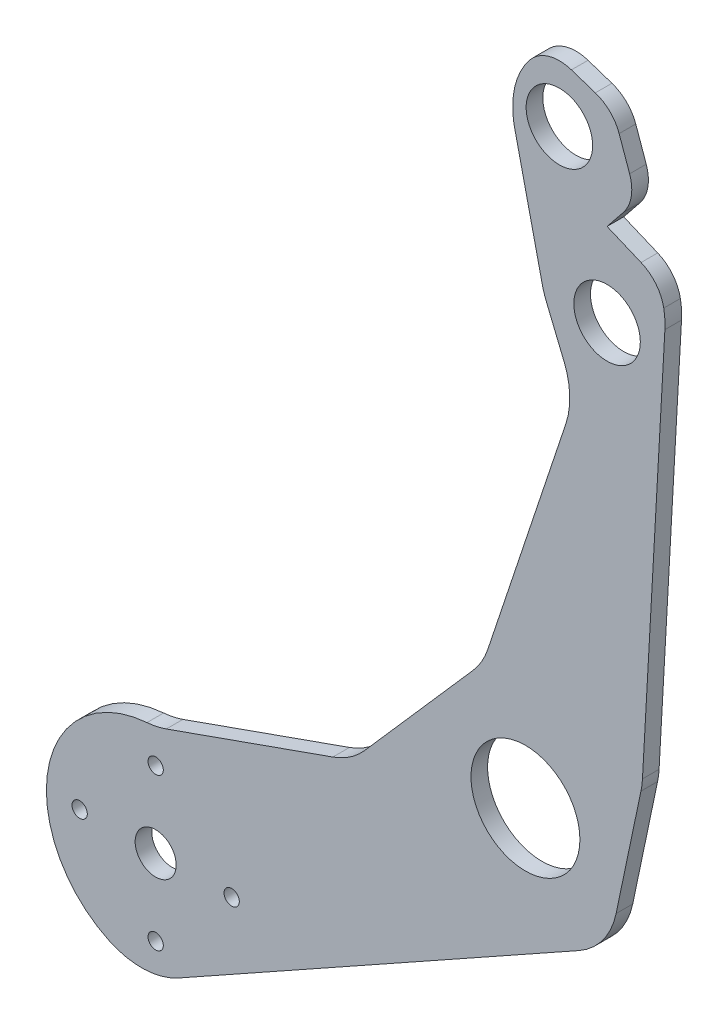
from build123d import *

# Parameters (mm, degrees)
SKETCH1_R           = 6.861165386
SKETCH1_R_2         = 18.200911839
SKETCH1_R_3         = 11.1125
SKETCH1_R_4         = 2.5527
BOSS_EXTRUDE1_DEPTH = 5.55625
FILLET1_R           = 25.4
FILLET3_R           = 12.7
FILLET4_R           = 12.7


with BuildPart() as part:
    # Sketch1 → Boss-Extrude1 (new body)
    with BuildSketch(Plane.XY):
        with BuildLine():
            Line((198.861588808, 69.615973931), (188.964925061, 57.285610842))
            Line((188.964925061, 57.285610842), (205.711419625, 50.270822653))
            Line((205.711419625, 50.270822653), (208.580766503, 42.167272229))
            Line((208.580766503, 42.167272229), (200.684125291, -98.616772294))
            Line((200.684125291, -98.616772294), (189.611167808, -151.385643895))
            Line((189.611167808, -151.385643895), (38.107034572, -236.120024372))
            ThreePointArc((38.107034572, -236.120024372), (1.581834572, -199.594824372), (38.107034572, -163.069624372))
            Line((38.107034572, -163.069624372), (103.581383992, -139.886129452))
            Line((103.581383992, -139.886129452), (147.550432491, -89.7457244))
            Line((147.550432491, -89.7457244), (171.836242771, -16.814689905))
            Line((171.836242771, -16.814689905), (178.189444477, 2.26417003))
            Line((178.189444477, 2.26417003), (167.830043749, 27.447208055))
            Line((167.830043749, 27.447208055), (157.470643022, 73.010133983))
            Line((157.470643022, 73.010133983), (157.470643022, 93.390021886))
            Line((157.470643022, 93.390021886), (170.600142232, 98.791028052))
            Line((170.600142232, 98.791028052), (190.927975242, 92.021922153))
            Line((190.927975242, 92.021922153), (198.861588808, 69.615973931))
        make_face()
        with Locations((38.107034572, -199.594824372)):
            Circle(SKETCH1_R, mode=Mode.SUBTRACT)
        with Locations((161.686314612, -124.719021489)):
            Circle(SKETCH1_R_2, mode=Mode.SUBTRACT)
        with Locations((188.964925061, 29.396113336)):
            Circle(SKETCH1_R_3, mode=Mode.SUBTRACT)
        with Locations((173.035965272, 78.237579188)):
            Circle(SKETCH1_R_3, mode=Mode.SUBTRACT)
        with Locations((38.107034572, -174.194824372)):
            Circle(SKETCH1_R_4, mode=Mode.SUBTRACT)
        with Locations((63.507034572, -199.594824372)):
            Circle(SKETCH1_R_4, mode=Mode.SUBTRACT)
        with Locations((38.107034572, -224.994824372)):
            Circle(SKETCH1_R_4, mode=Mode.SUBTRACT)
        with Locations((12.707034572, -199.594824372)):
            Circle(SKETCH1_R_4, mode=Mode.SUBTRACT)
    extrude(amount=BOSS_EXTRUDE1_DEPTH)

    # Fillet1
    # the kernel refuses this fillet: 25.4 mm, written as the material it adds along each edge
    with BuildSketch(Plane(origin=(178.189444477, 2.26417003, 0), x_dir=(-0.38043310119112933, 0.9248084426074947, 0), z_dir=(0, 0, 1))) as fillet1_piece_1:
        with BuildLine():
            CenterArc((FILLET1_R * 0.371679258358, FILLET1_R), FILLET1_R, 229.221887669, 40.778112331)
            Line((-FILLET1_R * 0.281452116845, FILLET1_R * 0.242755385146), (0, 0))
            Line((0, 0), (FILLET1_R * 0.371679258358, 0))
        make_face()
    extrude(amount=5.55625)
    with BuildSketch(Plane(origin=(147.550432491, -89.7457244, 0), x_dir=(0.315940492730092, 0.948779007489872, 0), z_dir=(0, 0, 1))) as fillet1_piece_2:
        with BuildLine():
            CenterArc((FILLET1_R * 0.201912574353, FILLET1_R), FILLET1_R, 247.169477311, 22.830522689)
            Line((-FILLET1_R * 0.186094053331, FILLET1_R * 0.0783434170618), (0, 0))
            Line((0, 0), (FILLET1_R * 0.201912574353, 0))
        make_face()
    extrude(amount=5.55625)
    with BuildSketch(Plane(origin=(103.581383992, -139.886129452, 0), x_dir=(-0.9426514039125685, -0.333778864971501, 0), z_dir=(0, 0, 1))) as fillet1_piece_3:
        with BuildLine():
            CenterArc((FILLET1_R * 0.26097983986, -FILLET1_R), FILLET1_R, 90, 29.253579042)
            Line((-FILLET1_R * 0.22769590207, -FILLET1_R * 0.127534516872), (0, 0))
            Line((0, 0), (FILLET1_R * 0.26097983986, 0))
        make_face()
    extrude(amount=5.55625)
    with BuildSketch(Plane(origin=(38.107034572, -163.069624372, 0), x_dir=(0.9426514039125696, 0.3337788649714982, 0), z_dir=(0, 0, 1))) as fillet1_piece_4:
        with BuildLine():
            CenterArc((3.778567788, 25.4), FILLET1_R, 255.05508403, 14.94491597)
            ThreePointArc((-2.771845496, 0.85917512), (-1.377386631, 0.457126529), (0, 0))
            Line((0, 0), (3.778567788, 0))
        make_face()
    extrude(amount=5.55625)
    # the kernel refuses this fillet: 25.4 mm, written as the material it takes off along each edge
    with BuildSketch(Plane(origin=(157.470643022, 93.390021886, -42.096203676), x_dir=(0, -1, 0), z_dir=(0, 0, 1))) as fillet1_2_piece_1:
        with BuildLine():
            CenterArc((16.83848147, 25.4), FILLET1_R, 208.887448124, 61.112551876)
            Line((-5.401006167, 13.12949921), (0, 0))
            Line((0, 0), (16.83848147, 0))
        make_face()
    extrude(amount=89.748657352, mode=Mode.SUBTRACT)
    with BuildSketch(Plane(origin=(157.470643022, 73.010133983, -7.12787144), x_dir=(0.22170637645104777, -0.9751134716744232, 0), z_dir=(0, 0, 1))) as fillet1_2_piece_2:
        with BuildLine():
            CenterArc((FILLET1_R * 0.11224994393, FILLET1_R), FILLET1_R, 257.190723516, 12.809276484)
            Line((-FILLET1_R * 0.109456432521, FILLET1_R * 0.0248865283256), (0, 0))
            Line((0, 0), (FILLET1_R * 0.11224994393, 0))
        make_face()
    extrude(amount=19.811992879, mode=Mode.SUBTRACT)
    with BuildSketch(Plane(origin=(167.830043749, 27.447208055, -5.305032246), x_dir=(0.3804331011911332, -0.9248084426074932, 0), z_dir=(0, 0, 1))) as fillet1_2_piece_3:
        with BuildLine():
            CenterArc((FILLET1_R * 0.0835438149047, FILLET1_R), FILLET1_R, 260.448763965, 9.551236035)
            Line((-FILLET1_R * 0.0823856984158, FILLET1_R * 0.0138623845481), (0, 0))
            Line((0, 0), (FILLET1_R * 0.0835438149047, 0))
        make_face()
    extrude(amount=16.166314493, mode=Mode.SUBTRACT)
    with BuildSketch(Plane(origin=(38.107034572, -236.120024372, -39.792317969), x_dir=(0.8727709569033328, 0.48812995891057614, 0), z_dir=(0, 0, 1))) as fillet1_2_piece_4:
        with BuildLine():
            CenterArc((8.784495846, 25.4), FILLET1_R, 215.61203078, 54.38796922)
            ThreePointArc((-11.865158329, 10.609740285), (-6.517544718, 4.650687408), (0, 0))
            Line((0, 0), (8.784495846, 0))
        make_face()
    extrude(amount=85.140885938, mode=Mode.SUBTRACT)
    with BuildSketch(Plane(origin=(189.611167808, -151.385643895, -28.892669195), x_dir=(0.20536614533433253, 0.9786852131050707, 0), z_dir=(0, 0, 1))) as fillet1_2_piece_5:
        with BuildLine():
            CenterArc((FILLET1_R * 0.455002664481, FILLET1_R), FILLET1_R, 221.068676821, 48.931323179)
            Line((-FILLET1_R * 0.298919997384, FILLET1_R * 0.343036819962), (0, 0))
            Line((0, 0), (FILLET1_R * 0.455002664481, 0))
        make_face()
    extrude(amount=63.341588389, mode=Mode.SUBTRACT)
    with BuildSketch(Plane(origin=(200.684125291, -98.616772294, -4.797187782), x_dir=(0.056002429151398234, 0.9984306325074078, 0), z_dir=(0, 0, 1))) as fillet1_2_piece_6:
        with BuildLine():
            CenterArc((FILLET1_R * 0.075546264279, FILLET1_R), FILLET1_R, 261.359448749, 8.640551251)
            Line((-FILLET1_R * 0.0746888367943, FILLET1_R * 0.0113497006497), (0, 0))
            Line((0, 0), (FILLET1_R * 0.075546264279, 0))
        make_face()
    extrude(amount=15.150625563, mode=Mode.SUBTRACT)
    with BuildSketch(Plane(origin=(208.580766503, 42.167272229, -12.751193258), x_dir=(-0.33377886497150366, 0.9426514039125676, 0), z_dir=(0, 0, 1))) as fillet1_2_piece_7:
        with BuildLine():
            CenterArc((FILLET1_R * 0.200806193046, FILLET1_R), FILLET1_R, 247.291319111, 22.708680889)
            Line((-FILLET1_R * 0.185239618687, FILLET1_R * 0.0775203897954), (0, 0))
            Line((0, 0), (FILLET1_R * 0.200806193046, 0))
        make_face()
    extrude(amount=31.058636517, mode=Mode.SUBTRACT)

    # Fillet3
    fillet3_edges = [part.edges().sort_by_distance(p)[0] for p in [
        (170.600142232, 98.791028052, 2.778125),
        (190.927975242, 92.021922153, 2.778125),
    ]]
    fillet(fillet3_edges, radius=FILLET3_R)

    # Fillet4
    fillet4_edges = [part.edges().sort_by_distance(p)[0] for p in [
        (205.711419625, 50.270822653, 2.778125),
        (198.861588808, 69.615973931, 2.778125),
    ]]
    fillet(fillet4_edges, radius=FILLET4_R)


solid = part.part
